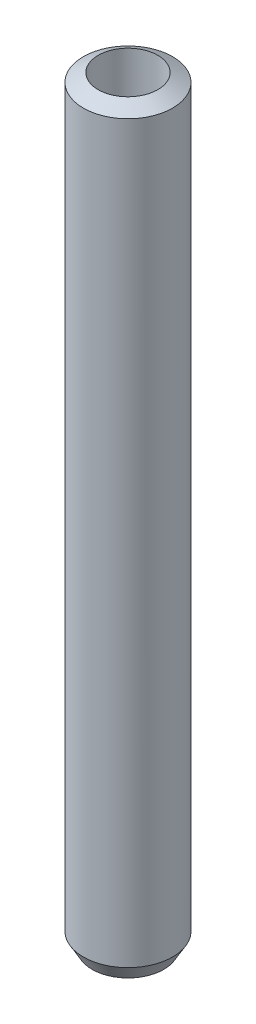
from build123d import *

# Parameters (mm, degrees)
SKETCH1_R           = 15
BOSS_EXTRUDE1_DEPTH = 255.247168
SKETCH2_R           = 10.021824618
CUT_EXTRUDE1_DEPTH  = 257.127149619
CHAMFER1_SIZE       = 2.938498
CHAMFER1_SIZE_2     = 5.089627


with BuildPart() as part:
    # Sketch1 → Boss-Extrude1 (new body)
    with BuildSketch(Plane(origin=(0, 0, 0), x_dir=(1, 0, 0), z_dir=(0, 1, 0))):
        with Locations(Location((0, 0, 0), (0, 0, 270))):
            Circle(SKETCH1_R)
    extrude(amount=BOSS_EXTRUDE1_DEPTH)

    # Sketch2 → Cut-Extrude1 (cut, through all)
    with BuildSketch(Plane(origin=(0, 0, 0), x_dir=(1, 0, 0), z_dir=(0, 1, 0))):
        with Locations(Location((0, 0, 0), (0, 0, 270))):
            Circle(SKETCH2_R)
    extrude(amount=CUT_EXTRUDE1_DEPTH, mode=Mode.SUBTRACT)

    # Chamfer1
    # the kernel refuses this chamfer: 5.089627, 2.938498 mm, written as the material it takes off along each edge
    with BuildSketch(Plane(origin=(0, 255.247168, 0), x_dir=(0, 0, 1), z_dir=(-1, 0, 0))) as chamfer1_piece_1:
        Polygon((15, -CHAMFER1_SIZE), (15 - CHAMFER1_SIZE_2, 0), (15, 0), align=None)
    revolve(axis=Axis((0, 255.247168, 0), (0, 1, 0)), mode=Mode.SUBTRACT)
    with BuildSketch(Plane(origin=(0, 0, 0), x_dir=(0, 0, 1), z_dir=(-1, 0, 0))) as chamfer1_piece_2:
        Polygon((15, CHAMFER1_SIZE_2), (15 - CHAMFER1_SIZE, 0), (15, 0), align=None)
    revolve(axis=Axis((0, 0, 0), (0, 1, 0)), mode=Mode.SUBTRACT)


solid = part.part
